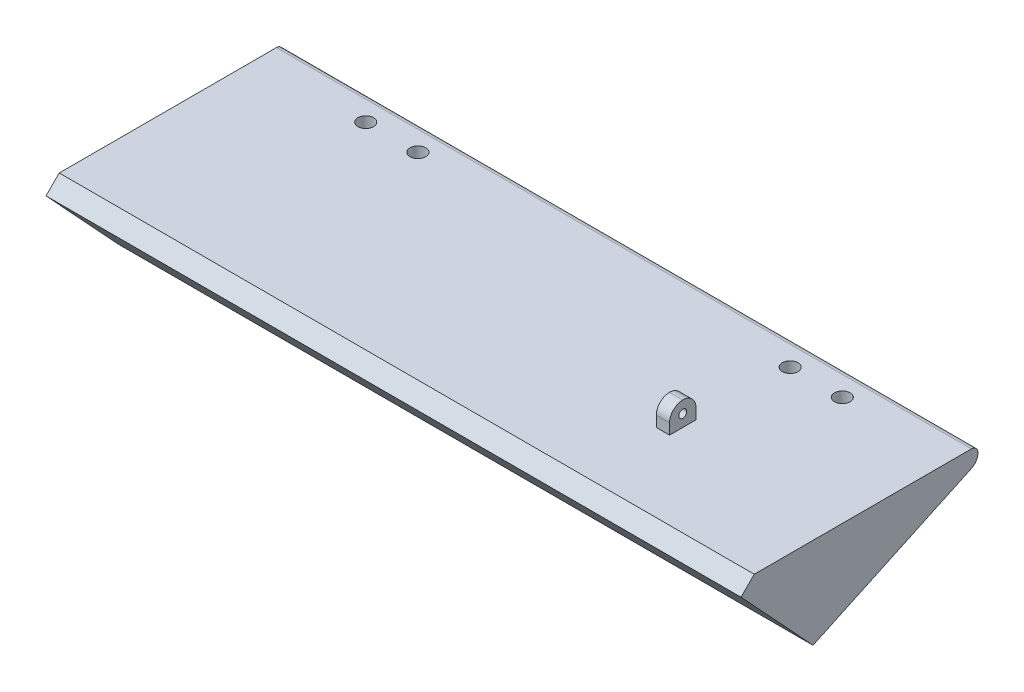
from build123d import *

# Parameters (mm, degrees)
SKETCH1_W           = 133.35
SKETCH1_H           = 45.466
BOSS_EXTRUDE1_DEPTH = 2.54
CUT_EXTRUDE1_DEPTH  = 141.91072087
SKETCH4_W           = 2.54
SKETCH4_H           = 5.08
BOSS_EXTRUDE2_DEPTH = 4.572
SKETCH5_R           = 0.762
CUT_EXTRUDE2_DEPTH  = 112.999023942
FILLET1_R           = 2.54
FILLET2_R           = 2.54
FILLET3_R           = 1.27
BOSS_EXTRUDE4_DEPTH = 133.35
SKETCH10_R          = 1.4986
CUT_EXTRUDE3_DEPTH  = 2.54


with BuildPart() as part:
    # Sketch1 → Boss-Extrude1 (new body)
    with BuildSketch(Plane(origin=(0, 0, 0), x_dir=(1, 0, 0), z_dir=(0, 1, 0))):
        with Locations((66.675, -22.733)):
            Rectangle(SKETCH1_W, SKETCH1_H)
    extrude(amount=BOSS_EXTRUDE1_DEPTH)

    # Sketch2 → Cut-Extrude1 (cut, through all)
    with BuildSketch(Plane(origin=(133.35, 0, 0), x_dir=(0, 0, -1), z_dir=(1, 0, 0))):
        Polygon((-45.466, 0), (-45.466, 2.54), (-42.926, 2.54), align=None)
    extrude(amount=-CUT_EXTRUDE1_DEPTH, mode=Mode.SUBTRACT)

    # Sketch4 → Boss-Extrude2 (add)
    with BuildSketch(Plane(origin=(0, 2.54, 0), x_dir=(1, 0, 0), z_dir=(0, 1, 0))):
        with Locations((100.838, -25.4)):
            Rectangle(SKETCH4_W, SKETCH4_H)
    extrude(amount=BOSS_EXTRUDE2_DEPTH)

    # Sketch5 → Cut-Extrude2 (cut, through all)
    with BuildSketch(Plane(origin=(102.108, 0, 0), x_dir=(0, 0, -1), z_dir=(1, 0, 0))):
        with Locations((-25.4, 4.826)):
            Circle(SKETCH5_R)
    extrude(amount=-CUT_EXTRUDE2_DEPTH, mode=Mode.SUBTRACT)

    # Fillet1
    fillet1_edges = [part.edges().sort_by_distance(p)[0] for p in [
        (100.838, 7.112, 27.94),
    ]]
    fillet(fillet1_edges, radius=FILLET1_R)

    # Fillet2
    fillet2_edges = [part.edges().sort_by_distance(p)[0] for p in [
        (100.838, 7.112, 22.86),
    ]]
    fillet(fillet2_edges, radius=FILLET2_R - 0.0001)  # a hair under: the kernel refuses the full size

    # Fillet3
    fillet3_edges = [part.edges().sort_by_distance(p)[0] for p in [
        (66.675, 0, 0),
        (66.675, 2.54, 0),
    ]]
    fillet(fillet3_edges, radius=FILLET3_R - 0.0001)  # a hair under: the kernel refuses the full size

    # Sketch8 → Boss-Extrude4 (add)
    with BuildSketch(Plane.ZY):
        Polygon((1.27, -0.724150623), (31.652500271, -14.902671748), (45.466, 0), (1.27, 0), align=None)
        with BuildLine():
            ThreePointArc((0, 1.27), (0.344458941, 0.087889947), (1.27, -0.724150623))
            Line((1.27, -0.724150623), (1.27, 0))
            ThreePointArc((1.27, 0), (0.371974388, 0.371974388), (0, 1.27))
        make_face()
    extrude(amount=-BOSS_EXTRUDE4_DEPTH)

    # Sketch10 → Cut-Extrude3 (cut)
    with BuildSketch(Plane(origin=(0, 2.54, 0.507603591), x_dir=(1, 0, 0), z_dir=(0, -1, 0))):
        with Locations(Location((20.955, 4.572396409, 0), (0, 0, 270))):
            Circle(SKETCH10_R)
        with Locations(Location((30.9626, 4.572396409, 0), (0, 0, 270))):
            Circle(SKETCH10_R)
        with Locations(Location((102.3874, 4.572396409, 0), (0, 0, 270))):
            Circle(SKETCH10_R)
        with Locations(Location((112.395, 4.572396409, 0), (0, 0, 270))):
            Circle(SKETCH10_R)
    extrude(amount=CUT_EXTRUDE3_DEPTH, mode=Mode.SUBTRACT)


solid = part.part
